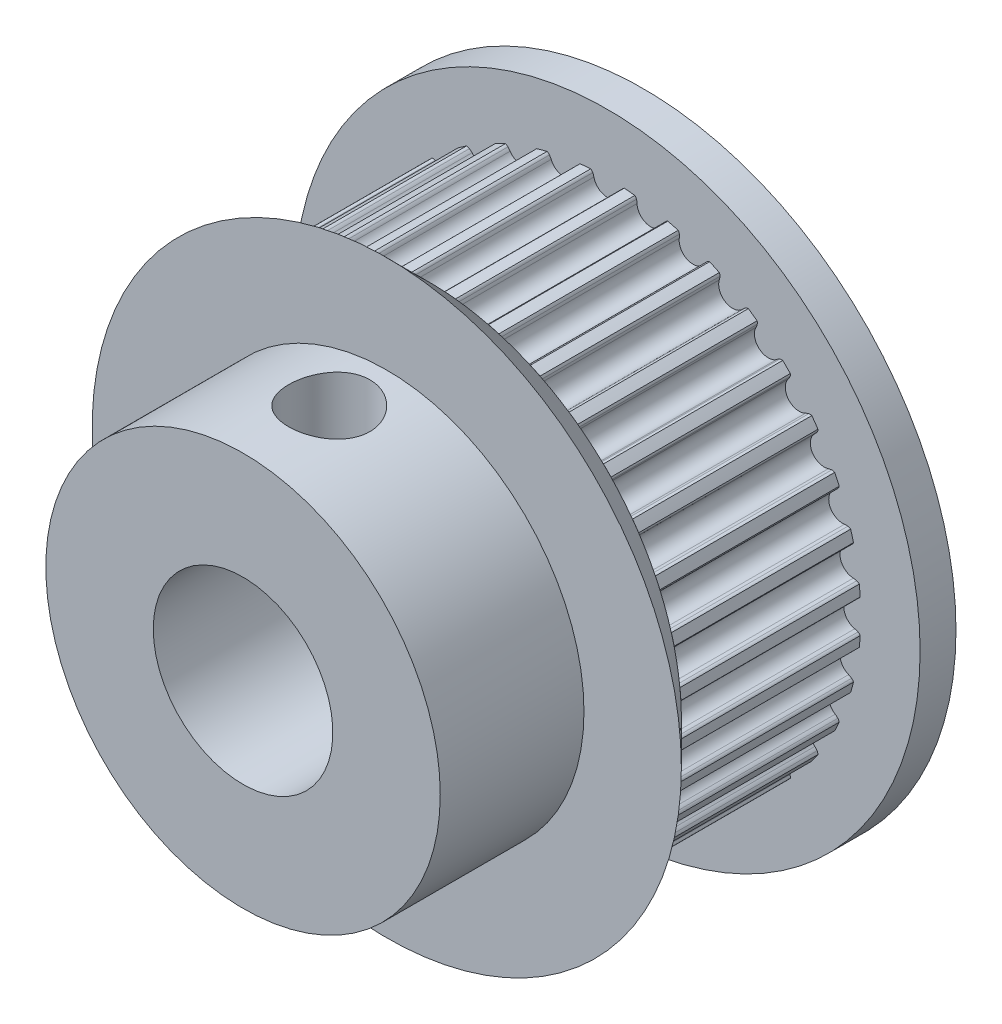
from build123d import *

# Parameters (mm, degrees)
BOSS_EXTRUDE1_DEPTH  = 7.9375
SKETCH3_R            = 13.843
BOSS_EXTRUDE2_DEPTH  = 1.5875
SKETCH4_R            = 8.73125
BOSS_EXTRUDE3_DEPTH  = 6.3627
M7_CLEARANCE_HOLE1_D = 7.9502
SKETCH7_W            = 1.8
SKETCH7_H            = 10.457240976


with BuildPart() as part:
    # Sketch1 → Revolve1 (revolve)
    with BuildSketch(Plane(origin=(0, 0, 0), x_dir=(1, 0, 0), z_dir=(0, 1, 0))):
        Polygon((11.21, -3.96875), (0, -3.96875), (0, -5.801119912), (13.042369912, -5.801119912), align=None)
    revolve(axis=Axis((0, 0, 3.96875), (0, 0, 1)))

    # Sketch2 → Boss-Extrude1 (add)
    with BuildSketch(Plane(origin=(0, 0, 3.96875), x_dir=(-1, 0, 0), z_dir=(0, 0, -1))):
        with BuildLine():
            ThreePointArc((-3.130872157, 10.768178971), (-2.902422654, 10.831988809), (-2.672674661, 10.89095262))
            ThreePointArc((-2.672674661, 10.89095262), (-2.613516844, 10.858268025), (-2.566342482, 10.809868545))
            ThreePointArc((-2.566342482, 10.809868545), (-2.525361974, 10.745532294), (-2.492197715, 10.676839592))
            ThreePointArc((-2.492197715, 10.676839592), (-1.81719345, 10.305816174), (-1.309794405, 10.885329198))
            ThreePointArc((-1.309794405, 10.885329198), (-1.302124483, 10.961222067), (-1.285619696, 11.035694527))
            ThreePointArc((-1.285619696, 11.035694527), (-1.257843893, 11.097309743), (-1.213432519, 11.148256381))
            ThreePointArc((-1.213432519, 11.148256381), (-0.977373215, 11.171426964), (-0.740876652, 11.189599662))
            ThreePointArc((-0.740876652, 11.189599662), (-0.688293196, 11.147138972), (-0.65024, 11.091283047))
            ThreePointArc((-0.65024, 11.091283047), (-0.62105395, 11.020808018), (-0.600321894, 10.9474))
            ThreePointArc((-0.600321894, 10.9474), (0, 10.4648), (0.600321894, 10.9474))
            ThreePointArc((0.600321894, 10.9474), (0.62105395, 11.020808018), (0.65024, 11.091283047))
            ThreePointArc((0.65024, 11.091283047), (0.688293196, 11.147138972), (0.740876652, 11.189599662))
            ThreePointArc((0.740876652, 11.189599662), (0.977373215, 11.171426964), (1.213432519, 11.148256381))
            ThreePointArc((1.213432519, 11.148256381), (1.257843893, 11.097309743), (1.285619696, 11.035694527))
            ThreePointArc((1.285619696, 11.035694527), (1.302124483, 10.961222067), (1.309794405, 10.885329198))
            ThreePointArc((1.309794405, 10.885329198), (1.81719345, 10.305816174), (2.492197715, 10.676839592))
            ThreePointArc((2.492197715, 10.676839592), (2.525361974, 10.745532294), (2.566342482, 10.809868545))
            ThreePointArc((2.566342482, 10.809868545), (2.613516844, 10.858268025), (2.672674661, 10.89095262))
            ThreePointArc((2.672674661, 10.89095262), (2.902422654, 10.831988809), (3.130872157, 10.768178971))
            ThreePointArc((3.130872157, 10.768178971), (3.165762032, 10.710294373), (3.182416488, 10.644792012))
            ThreePointArc((3.182416488, 10.644792012), (3.185738524, 10.56858493), (3.180113263, 10.492513177))
            ThreePointArc((3.180113263, 10.492513177), (3.579172396, 9.833695338), (4.308349371, 10.081868817))
            ThreePointArc((4.308349371, 10.081868817), (4.352938152, 10.143759008), (4.404467947, 10.200001656))
            ThreePointArc((4.404467947, 10.200001656), (4.459330106, 10.239474098), (4.523264803, 10.261389493))
            ThreePointArc((4.523264803, 10.261389493), (4.739283449, 10.163426155), (4.953181829, 10.060915892))
            ThreePointArc((4.953181829, 10.060915892), (4.977490093, 9.997852127), (4.982517165, 9.930452879))
            ThreePointArc((4.982517165, 9.930452879), (4.972555511, 9.854826689), (4.95380599, 9.780887452))
            ThreePointArc((4.95380599, 9.780887452), (5.2324, 9.062782646), (5.99359401, 9.180565559))
            ThreePointArc((5.99359401, 9.180565559), (6.048252507, 9.233772738), (6.108765882, 9.280212879))
            ThreePointArc((6.108765882, 9.280212879), (6.169648879, 9.309558932), (6.236417833, 9.320039239))
            ThreePointArc((6.236417833, 9.320039239), (6.432143515, 9.18605294), (6.624991577, 9.047956974))
            ThreePointArc((6.624991577, 9.047956974), (6.637979637, 8.981630204), (6.631226579, 8.914381961))
            ThreePointArc((6.631226579, 8.914381961), (6.608283915, 8.841634525), (6.576979828, 8.772074412))
            ThreePointArc((6.576979828, 8.772074412), (6.726643778, 8.016501888), (7.496726329, 8.000315462))
            ThreePointArc((7.496726329, 8.000315462), (7.55979377, 8.043222957), (7.627452057, 8.07844953))
            ThreePointArc((7.627452057, 8.07844953), (7.692505993, 8.096777528), (7.760080463, 8.095504309))
            ThreePointArc((7.760080463, 8.095504309), (7.929566155, 7.929566155), (8.095504309, 7.760080463))
            ThreePointArc((8.095504309, 7.760080463), (8.096777528, 7.692505993), (8.07844953, 7.627452057))
            ThreePointArc((8.07844953, 7.627452057), (8.043222957, 7.55979377), (8.000315462, 7.496726329))
            ThreePointArc((8.000315462, 7.496726329), (8.016501888, 6.726643778), (8.772074412, 6.576979828))
            ThreePointArc((8.772074412, 6.576979828), (8.841634525, 6.608283915), (8.914381961, 6.631226579))
            ThreePointArc((8.914381961, 6.631226579), (8.981630204, 6.637979637), (9.047956974, 6.624991577))
            ThreePointArc((9.047956974, 6.624991577), (9.18605294, 6.432143515), (9.320039239, 6.236417833))
            ThreePointArc((9.320039239, 6.236417833), (9.309558932, 6.169648879), (9.280212879, 6.108765882))
            ThreePointArc((9.280212879, 6.108765882), (9.233772738, 6.048252507), (9.180565559, 5.99359401))
            ThreePointArc((9.180565559, 5.99359401), (9.062782646, 5.2324), (9.780887452, 4.95380599))
            ThreePointArc((9.780887452, 4.95380599), (9.854826689, 4.972555511), (9.930452879, 4.982517165))
            ThreePointArc((9.930452879, 4.982517165), (9.997852127, 4.977490093), (10.060915892, 4.953181829))
            ThreePointArc((10.060915892, 4.953181829), (10.163426155, 4.739283449), (10.261389493, 4.523264803))
            ThreePointArc((10.261389493, 4.523264803), (10.239474098, 4.459330106), (10.200001656, 4.404467947))
            ThreePointArc((10.200001656, 4.404467947), (10.143759008, 4.352938152), (10.081868817, 4.308349371))
            ThreePointArc((10.081868817, 4.308349371), (9.833695338, 3.579172396), (10.492513177, 3.180113263))
            ThreePointArc((10.492513177, 3.180113263), (10.56858493, 3.185738524), (10.644792012, 3.182416488))
            ThreePointArc((10.644792012, 3.182416488), (10.710294373, 3.165762032), (10.768178971, 3.130872157))
            ThreePointArc((10.768178971, 3.130872157), (10.831988809, 2.902422654), (10.89095262, 2.672674661))
            ThreePointArc((10.89095262, 2.672674661), (10.858268025, 2.613516844), (10.809868545, 2.566342482))
            ThreePointArc((10.809868545, 2.566342482), (10.745532294, 2.525361974), (10.676839592, 2.492197715))
            ThreePointArc((10.676839592, 2.492197715), (10.305816174, 1.81719345), (10.885329198, 1.309794405))
            ThreePointArc((10.885329198, 1.309794405), (10.961222067, 1.302124483), (11.035694527, 1.285619696))
            ThreePointArc((11.035694527, 1.285619696), (11.097309743, 1.257843893), (11.148256381, 1.213432519))
            ThreePointArc((11.148256381, 1.213432519), (11.171426964, 0.977373215), (11.189599662, 0.740876652))
            ThreePointArc((11.189599662, 0.740876652), (11.147138972, 0.688293196), (11.091283047, 0.65024))
            ThreePointArc((11.091283047, 0.65024), (11.020808018, 0.62105395), (10.9474, 0.600321894))
            ThreePointArc((10.9474, 0.600321894), (10.4648, 0), (10.9474, -0.600321894))
            ThreePointArc((10.9474, -0.600321894), (11.020808018, -0.62105395), (11.091283047, -0.65024))
            ThreePointArc((11.091283047, -0.65024), (11.147138972, -0.688293196), (11.189599662, -0.740876652))
            ThreePointArc((11.189599662, -0.740876652), (11.171426964, -0.977373215), (11.148256381, -1.213432519))
            ThreePointArc((11.148256381, -1.213432519), (11.097309743, -1.257843893), (11.035694527, -1.285619696))
            ThreePointArc((11.035694527, -1.285619696), (10.961222067, -1.302124483), (10.885329198, -1.309794405))
            ThreePointArc((10.885329198, -1.309794405), (10.305816174, -1.81719345), (10.676839592, -2.492197715))
            ThreePointArc((10.676839592, -2.492197715), (10.745532294, -2.525361974), (10.809868545, -2.566342482))
            ThreePointArc((10.809868545, -2.566342482), (10.858268025, -2.613516844), (10.89095262, -2.672674661))
            ThreePointArc((10.89095262, -2.672674661), (10.831988809, -2.902422654), (10.768178971, -3.130872157))
            ThreePointArc((10.768178971, -3.130872157), (10.710294373, -3.165762032), (10.644792012, -3.182416488))
            ThreePointArc((10.644792012, -3.182416488), (10.56858493, -3.185738524), (10.492513177, -3.180113263))
            ThreePointArc((10.492513177, -3.180113263), (9.833695338, -3.579172396), (10.081868817, -4.308349371))
            ThreePointArc((10.081868817, -4.308349371), (10.143759008, -4.352938152), (10.200001656, -4.404467947))
            ThreePointArc((10.200001656, -4.404467947), (10.239474098, -4.459330106), (10.261389493, -4.523264803))
            ThreePointArc((10.261389493, -4.523264803), (10.163426155, -4.739283449), (10.060915892, -4.953181829))
            ThreePointArc((10.060915892, -4.953181829), (9.997852127, -4.977490093), (9.930452879, -4.982517165))
            ThreePointArc((9.930452879, -4.982517165), (9.854826689, -4.972555511), (9.780887452, -4.95380599))
            ThreePointArc((9.780887452, -4.95380599), (9.062782646, -5.2324), (9.180565559, -5.99359401))
            ThreePointArc((9.180565559, -5.99359401), (9.233772738, -6.048252507), (9.280212879, -6.108765882))
            ThreePointArc((9.280212879, -6.108765882), (9.309558932, -6.169648879), (9.320039239, -6.236417833))
            ThreePointArc((9.320039239, -6.236417833), (9.18605294, -6.432143515), (9.047956974, -6.624991577))
            ThreePointArc((9.047956974, -6.624991577), (8.981630204, -6.637979637), (8.914381961, -6.631226579))
            ThreePointArc((8.914381961, -6.631226579), (8.841634525, -6.608283915), (8.772074412, -6.576979828))
            ThreePointArc((8.772074412, -6.576979828), (8.016501888, -6.726643778), (8.000315462, -7.496726329))
            ThreePointArc((8.000315462, -7.496726329), (8.043222957, -7.55979377), (8.07844953, -7.627452057))
            ThreePointArc((8.07844953, -7.627452057), (8.096777528, -7.692505993), (8.095504309, -7.760080463))
            ThreePointArc((8.095504309, -7.760080463), (7.929566155, -7.929566155), (7.760080463, -8.095504309))
            ThreePointArc((7.760080463, -8.095504309), (7.692505993, -8.096777528), (7.627452057, -8.07844953))
            ThreePointArc((7.627452057, -8.07844953), (7.55979377, -8.043222957), (7.496726329, -8.000315462))
            ThreePointArc((7.496726329, -8.000315462), (6.726643778, -8.016501888), (6.576979828, -8.772074412))
            ThreePointArc((6.576979828, -8.772074412), (6.608283915, -8.841634525), (6.631226579, -8.914381961))
            ThreePointArc((6.631226579, -8.914381961), (6.637979637, -8.981630204), (6.624991577, -9.047956974))
            ThreePointArc((6.624991577, -9.047956974), (6.432143515, -9.18605294), (6.236417833, -9.320039239))
            ThreePointArc((6.236417833, -9.320039239), (6.169648879, -9.309558932), (6.108765882, -9.280212879))
            ThreePointArc((6.108765882, -9.280212879), (6.048252507, -9.233772738), (5.99359401, -9.180565559))
            ThreePointArc((5.99359401, -9.180565559), (5.2324, -9.062782646), (4.95380599, -9.780887452))
            ThreePointArc((4.95380599, -9.780887452), (4.972555511, -9.854826689), (4.982517165, -9.930452879))
            ThreePointArc((4.982517165, -9.930452879), (4.977490093, -9.997852127), (4.953181829, -10.060915892))
            ThreePointArc((4.953181829, -10.060915892), (4.739283449, -10.163426155), (4.523264803, -10.261389493))
            ThreePointArc((4.523264803, -10.261389493), (4.459330106, -10.239474098), (4.404467947, -10.200001656))
            ThreePointArc((4.404467947, -10.200001656), (4.352938152, -10.143759008), (4.308349371, -10.081868817))
            ThreePointArc((4.308349371, -10.081868817), (3.579172396, -9.833695338), (3.180113263, -10.492513177))
            ThreePointArc((3.180113263, -10.492513177), (3.185738524, -10.56858493), (3.182416488, -10.644792012))
            ThreePointArc((3.182416488, -10.644792012), (3.165762032, -10.710294373), (3.130872157, -10.768178971))
            ThreePointArc((3.130872157, -10.768178971), (2.902422654, -10.831988809), (2.672674661, -10.89095262))
            ThreePointArc((2.672674661, -10.89095262), (2.613516844, -10.858268025), (2.566342482, -10.809868545))
            ThreePointArc((2.566342482, -10.809868545), (2.525361974, -10.745532294), (2.492197715, -10.676839592))
            ThreePointArc((2.492197715, -10.676839592), (1.81719345, -10.305816174), (1.309794405, -10.885329198))
            ThreePointArc((1.309794405, -10.885329198), (1.302124483, -10.961222067), (1.285619696, -11.035694527))
            ThreePointArc((1.285619696, -11.035694527), (1.257843893, -11.097309743), (1.213432519, -11.148256381))
            ThreePointArc((1.213432519, -11.148256381), (0.977373215, -11.171426964), (0.740876652, -11.189599662))
            ThreePointArc((0.740876652, -11.189599662), (0.688293196, -11.147138972), (0.65024, -11.091283047))
            ThreePointArc((0.65024, -11.091283047), (0.62105395, -11.020808018), (0.600321894, -10.9474))
            ThreePointArc((0.600321894, -10.9474), (0, -10.4648), (-0.600321894, -10.9474))
            ThreePointArc((-0.600321894, -10.9474), (-0.62105395, -11.020808018), (-0.65024, -11.091283047))
            ThreePointArc((-0.65024, -11.091283047), (-0.688293196, -11.147138972), (-0.740876652, -11.189599662))
            ThreePointArc((-0.740876652, -11.189599662), (-0.977373215, -11.171426964), (-1.213432519, -11.148256381))
            ThreePointArc((-1.213432519, -11.148256381), (-1.257843893, -11.097309743), (-1.285619696, -11.035694527))
            ThreePointArc((-1.285619696, -11.035694527), (-1.302124483, -10.961222067), (-1.309794405, -10.885329198))
            ThreePointArc((-1.309794405, -10.885329198), (-1.81719345, -10.305816174), (-2.492197715, -10.676839592))
            ThreePointArc((-2.492197715, -10.676839592), (-2.525361974, -10.745532294), (-2.566342482, -10.809868545))
            ThreePointArc((-2.566342482, -10.809868545), (-2.613516844, -10.858268025), (-2.672674661, -10.89095262))
            ThreePointArc((-2.672674661, -10.89095262), (-2.902422654, -10.831988809), (-3.130872157, -10.768178971))
            ThreePointArc((-3.130872157, -10.768178971), (-3.165762032, -10.710294373), (-3.182416488, -10.644792012))
            ThreePointArc((-3.182416488, -10.644792012), (-3.185738524, -10.56858493), (-3.180113263, -10.492513177))
            ThreePointArc((-3.180113263, -10.492513177), (-3.579172396, -9.833695338), (-4.308349371, -10.081868817))
            ThreePointArc((-4.308349371, -10.081868817), (-4.352938152, -10.143759008), (-4.404467947, -10.200001656))
            ThreePointArc((-4.404467947, -10.200001656), (-4.459330106, -10.239474098), (-4.523264803, -10.261389493))
            ThreePointArc((-4.523264803, -10.261389493), (-4.739283449, -10.163426155), (-4.953181829, -10.060915892))
            ThreePointArc((-4.953181829, -10.060915892), (-4.977490093, -9.997852127), (-4.982517165, -9.930452879))
            ThreePointArc((-4.982517165, -9.930452879), (-4.972555511, -9.854826689), (-4.95380599, -9.780887452))
            ThreePointArc((-4.95380599, -9.780887452), (-5.2324, -9.062782646), (-5.99359401, -9.180565559))
            ThreePointArc((-5.99359401, -9.180565559), (-6.048252507, -9.233772738), (-6.108765882, -9.280212879))
            ThreePointArc((-6.108765882, -9.280212879), (-6.169648879, -9.309558932), (-6.236417833, -9.320039239))
            ThreePointArc((-6.236417833, -9.320039239), (-6.432143515, -9.18605294), (-6.624991577, -9.047956974))
            ThreePointArc((-6.624991577, -9.047956974), (-6.637979637, -8.981630204), (-6.631226579, -8.914381961))
            ThreePointArc((-6.631226579, -8.914381961), (-6.608283915, -8.841634525), (-6.576979828, -8.772074412))
            ThreePointArc((-6.576979828, -8.772074412), (-6.726643778, -8.016501888), (-7.496726329, -8.000315462))
            ThreePointArc((-7.496726329, -8.000315462), (-7.55979377, -8.043222957), (-7.627452057, -8.07844953))
            ThreePointArc((-7.627452057, -8.07844953), (-7.692505993, -8.096777528), (-7.760080463, -8.095504309))
            ThreePointArc((-7.760080463, -8.095504309), (-7.929566155, -7.929566155), (-8.095504309, -7.760080463))
            ThreePointArc((-8.095504309, -7.760080463), (-8.096777528, -7.692505993), (-8.07844953, -7.627452057))
            ThreePointArc((-8.07844953, -7.627452057), (-8.043222957, -7.55979377), (-8.000315462, -7.496726329))
            ThreePointArc((-8.000315462, -7.496726329), (-8.016501888, -6.726643778), (-8.772074412, -6.576979828))
            ThreePointArc((-8.772074412, -6.576979828), (-8.841634525, -6.608283915), (-8.914381961, -6.631226579))
            ThreePointArc((-8.914381961, -6.631226579), (-8.981630204, -6.637979637), (-9.047956974, -6.624991577))
            ThreePointArc((-9.047956974, -6.624991577), (-9.18605294, -6.432143515), (-9.320039239, -6.236417833))
            ThreePointArc((-9.320039239, -6.236417833), (-9.309558932, -6.169648879), (-9.280212879, -6.108765882))
            ThreePointArc((-9.280212879, -6.108765882), (-9.233772738, -6.048252507), (-9.180565559, -5.99359401))
            ThreePointArc((-9.180565559, -5.99359401), (-9.062782646, -5.2324), (-9.780887452, -4.95380599))
            ThreePointArc((-9.780887452, -4.95380599), (-9.854826689, -4.972555511), (-9.930452879, -4.982517165))
            ThreePointArc((-9.930452879, -4.982517165), (-9.997852127, -4.977490093), (-10.060915892, -4.953181829))
            ThreePointArc((-10.060915892, -4.953181829), (-10.163426155, -4.739283449), (-10.261389493, -4.523264803))
            ThreePointArc((-10.261389493, -4.523264803), (-10.239474098, -4.459330106), (-10.200001656, -4.404467947))
            ThreePointArc((-10.200001656, -4.404467947), (-10.143759008, -4.352938152), (-10.081868817, -4.308349371))
            ThreePointArc((-10.081868817, -4.308349371), (-9.833695338, -3.579172396), (-10.492513177, -3.180113263))
            ThreePointArc((-10.492513177, -3.180113263), (-10.56858493, -3.185738524), (-10.644792012, -3.182416488))
            ThreePointArc((-10.644792012, -3.182416488), (-10.710294373, -3.165762032), (-10.768178971, -3.130872157))
            ThreePointArc((-10.768178971, -3.130872157), (-10.831988809, -2.902422654), (-10.89095262, -2.672674661))
            ThreePointArc((-10.89095262, -2.672674661), (-10.858268025, -2.613516844), (-10.809868545, -2.566342482))
            ThreePointArc((-10.809868545, -2.566342482), (-10.745532294, -2.525361974), (-10.676839592, -2.492197715))
            ThreePointArc((-10.676839592, -2.492197715), (-10.305816174, -1.81719345), (-10.885329198, -1.309794405))
            ThreePointArc((-10.885329198, -1.309794405), (-10.961222067, -1.302124483), (-11.035694527, -1.285619696))
            ThreePointArc((-11.035694527, -1.285619696), (-11.097309743, -1.257843893), (-11.148256381, -1.213432519))
            ThreePointArc((-11.148256381, -1.213432519), (-11.171426964, -0.977373215), (-11.189599662, -0.740876652))
            ThreePointArc((-11.189599662, -0.740876652), (-11.147138972, -0.688293196), (-11.091283047, -0.65024))
            ThreePointArc((-11.091283047, -0.65024), (-11.020808018, -0.62105395), (-10.9474, -0.600321894))
            ThreePointArc((-10.9474, -0.600321894), (-10.4648, 0), (-10.9474, 0.600321894))
            ThreePointArc((-10.9474, 0.600321894), (-11.020808018, 0.62105395), (-11.091283047, 0.65024))
            ThreePointArc((-11.091283047, 0.65024), (-11.147138972, 0.688293196), (-11.189599662, 0.740876652))
            ThreePointArc((-11.189599662, 0.740876652), (-11.171426964, 0.977373215), (-11.148256381, 1.213432519))
            ThreePointArc((-11.148256381, 1.213432519), (-11.097309743, 1.257843893), (-11.035694527, 1.285619696))
            ThreePointArc((-11.035694527, 1.285619696), (-10.961222067, 1.302124483), (-10.885329198, 1.309794405))
            ThreePointArc((-10.885329198, 1.309794405), (-10.305816174, 1.81719345), (-10.676839592, 2.492197715))
            ThreePointArc((-10.676839592, 2.492197715), (-10.745532294, 2.525361974), (-10.809868545, 2.566342482))
            ThreePointArc((-10.809868545, 2.566342482), (-10.858268025, 2.613516844), (-10.89095262, 2.672674661))
            ThreePointArc((-10.89095262, 2.672674661), (-10.831988809, 2.902422654), (-10.768178971, 3.130872157))
            ThreePointArc((-10.768178971, 3.130872157), (-10.710294373, 3.165762032), (-10.644792012, 3.182416488))
            ThreePointArc((-10.644792012, 3.182416488), (-10.56858493, 3.185738524), (-10.492513177, 3.180113263))
            ThreePointArc((-10.492513177, 3.180113263), (-9.833695338, 3.579172396), (-10.081868817, 4.308349371))
            ThreePointArc((-10.081868817, 4.308349371), (-10.143759008, 4.352938152), (-10.200001656, 4.404467947))
            ThreePointArc((-10.200001656, 4.404467947), (-10.239474098, 4.459330106), (-10.261389493, 4.523264803))
            ThreePointArc((-10.261389493, 4.523264803), (-10.163426155, 4.739283449), (-10.060915892, 4.953181829))
            ThreePointArc((-10.060915892, 4.953181829), (-9.997852127, 4.977490093), (-9.930452879, 4.982517165))
            ThreePointArc((-9.930452879, 4.982517165), (-9.854826689, 4.972555511), (-9.780887452, 4.95380599))
            ThreePointArc((-9.780887452, 4.95380599), (-9.062782646, 5.2324), (-9.180565559, 5.99359401))
            ThreePointArc((-9.180565559, 5.99359401), (-9.233772738, 6.048252507), (-9.280212879, 6.108765882))
            ThreePointArc((-9.280212879, 6.108765882), (-9.309558932, 6.169648879), (-9.320039239, 6.236417833))
            ThreePointArc((-9.320039239, 6.236417833), (-9.18605294, 6.432143515), (-9.047956974, 6.624991577))
            ThreePointArc((-9.047956974, 6.624991577), (-8.981630204, 6.637979637), (-8.914381961, 6.631226579))
            ThreePointArc((-8.914381961, 6.631226579), (-8.841634525, 6.608283915), (-8.772074412, 6.576979828))
            ThreePointArc((-8.772074412, 6.576979828), (-8.016501888, 6.726643778), (-8.000315462, 7.496726329))
            ThreePointArc((-8.000315462, 7.496726329), (-8.043222957, 7.55979377), (-8.07844953, 7.627452057))
            ThreePointArc((-8.07844953, 7.627452057), (-8.096777528, 7.692505993), (-8.095504309, 7.760080463))
            ThreePointArc((-8.095504309, 7.760080463), (-7.929566155, 7.929566155), (-7.760080463, 8.095504309))
            ThreePointArc((-7.760080463, 8.095504309), (-7.692505993, 8.096777528), (-7.627452057, 8.07844953))
            ThreePointArc((-7.627452057, 8.07844953), (-7.55979377, 8.043222957), (-7.496726329, 8.000315462))
            ThreePointArc((-7.496726329, 8.000315462), (-6.726643778, 8.016501888), (-6.576979828, 8.772074412))
            ThreePointArc((-6.576979828, 8.772074412), (-6.608283915, 8.841634525), (-6.631226579, 8.914381961))
            ThreePointArc((-6.631226579, 8.914381961), (-6.637979637, 8.981630204), (-6.624991577, 9.047956974))
            ThreePointArc((-6.624991577, 9.047956974), (-6.432143515, 9.18605294), (-6.236417833, 9.320039239))
            ThreePointArc((-6.236417833, 9.320039239), (-6.169648879, 9.309558932), (-6.108765882, 9.280212879))
            ThreePointArc((-6.108765882, 9.280212879), (-6.048252507, 9.233772738), (-5.99359401, 9.180565559))
            ThreePointArc((-5.99359401, 9.180565559), (-5.2324, 9.062782646), (-4.95380599, 9.780887452))
            ThreePointArc((-4.95380599, 9.780887452), (-4.972555511, 9.854826689), (-4.982517165, 9.930452879))
            ThreePointArc((-4.982517165, 9.930452879), (-4.977490093, 9.997852127), (-4.953181829, 10.060915892))
            ThreePointArc((-4.953181829, 10.060915892), (-4.739283449, 10.163426155), (-4.523264803, 10.261389493))
            ThreePointArc((-4.523264803, 10.261389493), (-4.459330106, 10.239474098), (-4.404467947, 10.200001656))
            ThreePointArc((-4.404467947, 10.200001656), (-4.352938152, 10.143759008), (-4.308349371, 10.081868817))
            ThreePointArc((-4.308349371, 10.081868817), (-3.579172396, 9.833695338), (-3.180113263, 10.492513177))
            ThreePointArc((-3.180113263, 10.492513177), (-3.185738524, 10.56858493), (-3.182416488, 10.644792012))
            ThreePointArc((-3.182416488, 10.644792012), (-3.165762032, 10.710294373), (-3.130872157, 10.768178971))
        make_face()
    extrude(amount=BOSS_EXTRUDE1_DEPTH)

    # Sketch3 → Boss-Extrude2 (add)
    with BuildSketch(Plane.XY.offset(-3.96875)):
        Circle(SKETCH3_R)
    extrude(amount=-BOSS_EXTRUDE2_DEPTH)

    # Sketch4 → Boss-Extrude3 (add)
    with BuildSketch(Plane.XY.offset(5.801119912)):
        Circle(SKETCH4_R)
    extrude(amount=BOSS_EXTRUDE3_DEPTH)

    # M7 Clearance Hole1 (through all)
    with Locations(Plane(origin=(0, 0, -5.55625), x_dir=(-1, 0, 0), z_dir=(0, 0, -1))):
        with Locations((0, 0)):
            Hole(M7_CLEARANCE_HOLE1_D / 2)

    # Sketch7 → M3 Clearance Hole1 (revolve, cut)
    with BuildSketch(Plane(origin=(0, 3.385759024, 8.347075), x_dir=(0, 0, -1), z_dir=(1, 0, 0))):
        with Locations((0.9, 5.228620488)):
            Rectangle(SKETCH7_W, SKETCH7_H)
    revolve(axis=Axis((0, -2.964240976, 8.347075), (0, 1, 0)), mode=Mode.SUBTRACT)


solid = part.part
